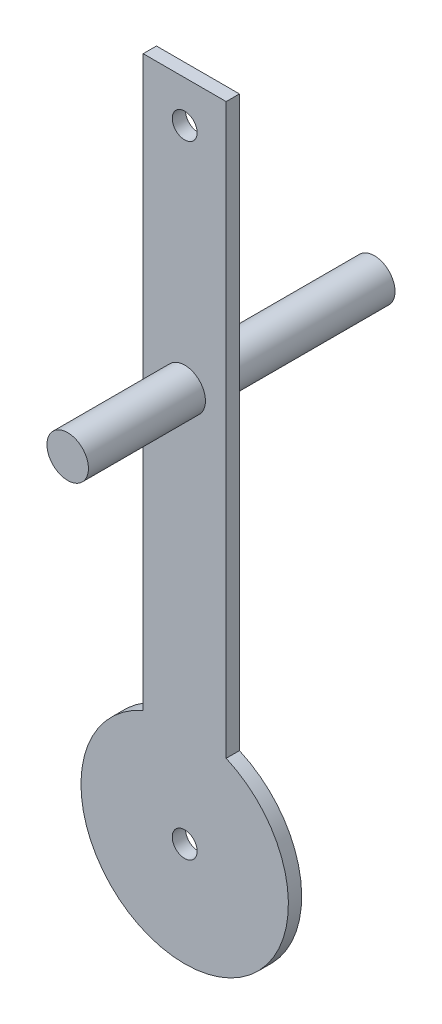
from build123d import *

# Parameters (mm, degrees)
SKETCH1_R           = 1.5
BOSS_EXTRUDE1_DEPTH = 1.6
SKETCH2_R           = 1.5
CUT_EXTRUDE1_DEPTH  = 71.7603683
SKETCH3_R           = 2.5
BOSS_EXTRUDE2_DEPTH = 14.1
BOSS_EXTRUDE3_START = 21.25
SKETCH4_R           = 2.5
BOSS_EXTRUDE3_DEPTH = 21.25


with BuildPart() as part:
    # Sketch1 → Boss-Extrude1 (new body)
    with BuildSketch(Plane.XY):
        with BuildLine():
            Line((0, 0), (0, 68.543560763))
            Line((0, 68.543560763), (10, 68.543560763))
            Line((10, 68.543560763), (10, 0))
            ThreePointArc((10, 0), (5, -23.956439237), (0, 0))
        make_face()
        with Locations((5, -11.456439237)):
            Circle(SKETCH1_R, mode=Mode.SUBTRACT)
    extrude(amount=BOSS_EXTRUDE1_DEPTH)

    # Sketch2 → Cut-Extrude1 (cut, through all)
    with BuildSketch(Plane.XY.offset(1.6)):
        with Locations((5, 63.543560763)):
            Circle(SKETCH2_R)
    extrude(amount=-CUT_EXTRUDE1_DEPTH, mode=Mode.SUBTRACT)

    # Sketch3 → Boss-Extrude2 (add)
    with BuildSketch(Plane.XY.offset(1.6)):
        with Locations((5, 36.043560763)):
            Circle(SKETCH3_R)
    extrude(amount=BOSS_EXTRUDE2_DEPTH)

    # Sketch4 → Boss-Extrude3 (add)
    with BuildSketch(Plane(origin=(0, 0, 0), x_dir=(-1, 0, 0), z_dir=(0, 0, -1)).offset(BOSS_EXTRUDE3_START)):
        with Locations((-5, 36.043560763)):
            Circle(SKETCH4_R)
    extrude(amount=-BOSS_EXTRUDE3_DEPTH)


solid = part.part
